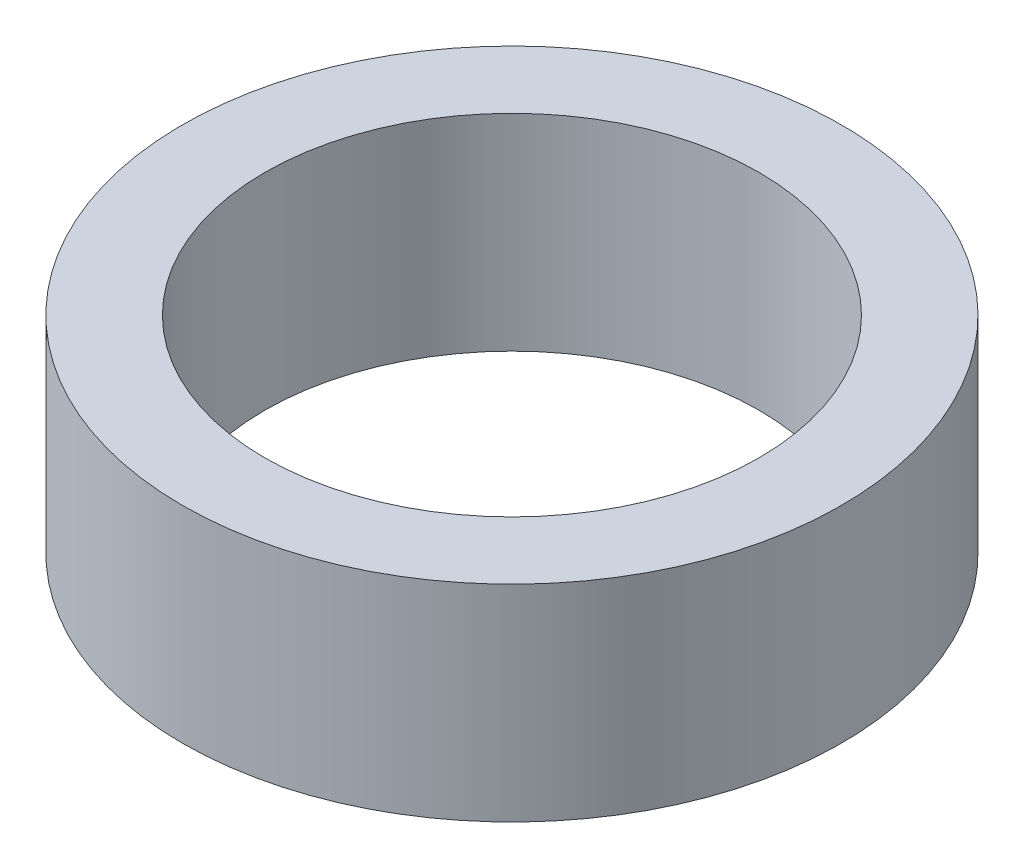
from build123d import *

# Parameters (mm, degrees)
SKETCH1_R           = 40
BOSS_EXTRUDE1_DEPTH = 25
SKETCH2_R           = 30
CUT_EXTRUDE1_DEPTH  = 62.846584384


with BuildPart() as part:
    # Sketch1 → Boss-Extrude1 (new body)
    with BuildSketch(Plane(origin=(0, 0, 0), x_dir=(1, 0, 0), z_dir=(0, 1, 0))):
        Circle(SKETCH1_R)
    extrude(amount=BOSS_EXTRUDE1_DEPTH)

    # Sketch2 → Cut-Extrude1 (cut, through all)
    with BuildSketch(Plane(origin=(0, 0, 0), x_dir=(1, 0, 0), z_dir=(0, 1, 0))):
        Circle(SKETCH2_R)
    extrude(amount=CUT_EXTRUDE1_DEPTH, mode=Mode.SUBTRACT)


solid = part.part
